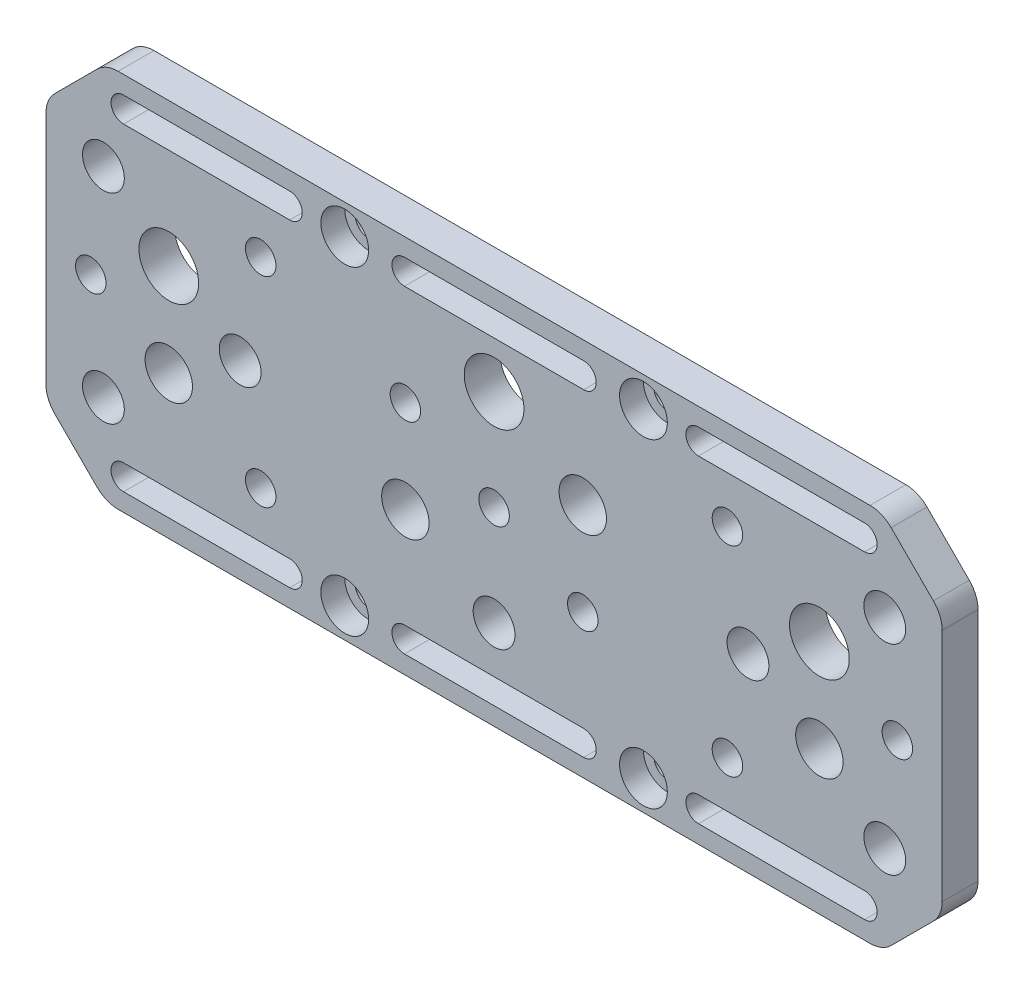
from build123d import *

# Parameters (mm, degrees)
EXTRUDE_2_DEPTH             = 6
HOLE_WIZARD_M41_D           = 4.5
HOLE_WIZARD_M41_CBORE_D     = 8
HOLE_WIZARD_M41_CBORE_DEPTH = 4
SKETCH_13_R                 = 5
SKETCH_13_R_2               = 3.5
CUT_EXTRUDE_1_DEPTH         = 82.664328198
FILLET_1_R                  = 5
HOLE_WIZARD_1_4_202_D       = 5.1054
HOLE_WIZARD_3_8_161_D       = 7.9375
HOLE_WIZARD_1_4_203_D       = 5.1054
HOLE_WIZARD_3_8_163_D       = 7.9375


with BuildPart() as part:
    # Эскиз5 → Бобышка-Вытянуть2 (new body)
    with BuildSketch(Plane.XY):
        Polygon((-75, 21.75), (-65, 31.75), (65, 31.75), (75, 21.75), (75, -21.75), (65, -31.75), (-65, -31.75), (-75, -21.75), align=None)
    extrude(amount=EXTRUDE_2_DEPTH)

    # Цековка для винта с внутренним шестигранником M41 (through all)
    with Locations(Plane.XY.offset(6)):
        with Locations((-25, 26.75), (-25, -26.75), (25, -26.75), (25, 26.75)):
            CounterBoreHole(HOLE_WIZARD_M41_D / 2, HOLE_WIZARD_M41_CBORE_D / 2, HOLE_WIZARD_M41_CBORE_DEPTH)

    # Эскиз13 → Вырез-Вытянуть1 (cut, through all)
    with BuildSketch(Plane.XY.offset(6)):
        with Locations((-54.451239655, 7.75)):
            Circle(SKETCH_13_R)
        with Locations((-65.388741386, 16.75)):
            Circle(SKETCH_13_R_2)
        with Locations((-65.388741386, -16.75)):
            Circle(SKETCH_13_R_2)
        with Locations((65.388741386, -16.75)):
            Circle(SKETCH_13_R_2)
        with Locations((54.451239655, 7.75)):
            Circle(SKETCH_13_R)
        with Locations((65.388741386, 16.75)):
            Circle(SKETCH_13_R_2)
        with Locations((0, -16.75)):
            Circle(SKETCH_13_R_2)
        with Locations((-42.5, 0)):
            Circle(SKETCH_13_R_2)
        with Locations((0, 16.75)):
            Circle(SKETCH_13_R)
        with Locations((42.5, 0)):
            Circle(SKETCH_13_R_2)
        with BuildLine():
            Line((-34.207920637, 24.55), (-62.016348651, 24.55))
            ThreePointArc((-62.016348651, 24.55), (-64.116348651, 26.65), (-62.016348651, 28.75))
            Line((-62.016348651, 28.75), (-34.207920637, 28.75))
            ThreePointArc((-34.207920637, 28.75), (-32.107920637, 26.65), (-34.207920637, 24.55))
        make_face()
        with BuildLine():
            Line((34.207920637, 24.55), (62.016348651, 24.55))
            ThreePointArc((62.016348651, 24.55), (64.116348651, 26.65), (62.016348651, 28.75))
            Line((62.016348651, 28.75), (34.207920637, 28.75))
            ThreePointArc((34.207920637, 28.75), (32.107920637, 26.65), (34.207920637, 24.55))
        make_face()
        with BuildLine():
            Line((-34.207920637, -24.55), (-62.016348651, -24.55))
            ThreePointArc((-62.016348651, -24.55), (-64.116348651, -26.65), (-62.016348651, -28.75))
            Line((-62.016348651, -28.75), (-34.207920637, -28.75))
            ThreePointArc((-34.207920637, -28.75), (-32.107920637, -26.65), (-34.207920637, -24.55))
        make_face()
        with BuildLine():
            Line((34.207920637, -24.55), (62.016348651, -24.55))
            ThreePointArc((62.016348651, -24.55), (64.116348651, -26.65), (62.016348651, -28.75))
            Line((62.016348651, -28.75), (34.207920637, -28.75))
            ThreePointArc((34.207920637, -28.75), (32.107920637, -26.65), (34.207920637, -24.55))
        make_face()
        with BuildLine():
            Line((-15, 28.75), (15, 28.75))
            ThreePointArc((15, 28.75), (17.1, 26.65), (15, 24.55))
            Line((15, 24.55), (-15, 24.55))
            ThreePointArc((-15, 24.55), (-17.1, 26.65), (-15, 28.75))
        make_face()
        with BuildLine():
            Line((-15, -28.75), (15, -28.75))
            ThreePointArc((15, -28.75), (17.1, -26.65), (15, -24.55))
            Line((15, -24.55), (-15, -24.55))
            ThreePointArc((-15, -24.55), (-17.1, -26.65), (-15, -28.75))
        make_face()
    extrude(amount=-CUT_EXTRUDE_1_DEPTH, mode=Mode.SUBTRACT)

    # Скругление1
    fillet_1_edges = [part.edges().sort_by_distance(p)[0] for p in [
        (65, 31.75, 3),
        (75, 21.75, 3),
        (75, -21.75, 3),
        (65, -31.75, 3),
        (-65, -31.75, 3),
        (-75, -21.75, 3),
        (-75, 21.75, 3),
        (-65, 31.75, 3),
    ]]
    fillet(fillet_1_edges, radius=FILLET_1_R)

    # Отверстие обработанное метчиком 1/4-202 (through all)
    with Locations(Plane.XY.offset(6)):
        with Locations((-67.5, 0), (-39.060049923, 16.75), (-39.060049923, -16.75), (39.060049923, 16.75), (39.060049923, -16.75), (67.5, 0)):
            Hole(HOLE_WIZARD_1_4_202_D / 2)

    # Отверстие обработанное метчиком 3/8-161 (through all)
    with Locations(Plane.XY.offset(6)):
        with Locations((-54.451239655, -7.75), (54.451239655, -7.75)):
            Hole(HOLE_WIZARD_3_8_161_D / 2)

    # Отверстие обработанное метчиком 1/4-203 (through all)
    with Locations(Plane.XY.offset(6)):
        with Locations((0, 0), (-14.849242405, 7.75), (14.849242405, -7.75)):
            Hole(HOLE_WIZARD_1_4_203_D / 2)

    # Отверстие обработанное метчиком 3/8-163 (through all)
    with Locations(Plane.XY.offset(6)):
        with Locations((-14.849242405, -7.75), (14.849242405, 7.75)):
            Hole(HOLE_WIZARD_3_8_163_D / 2)


solid = part.part
